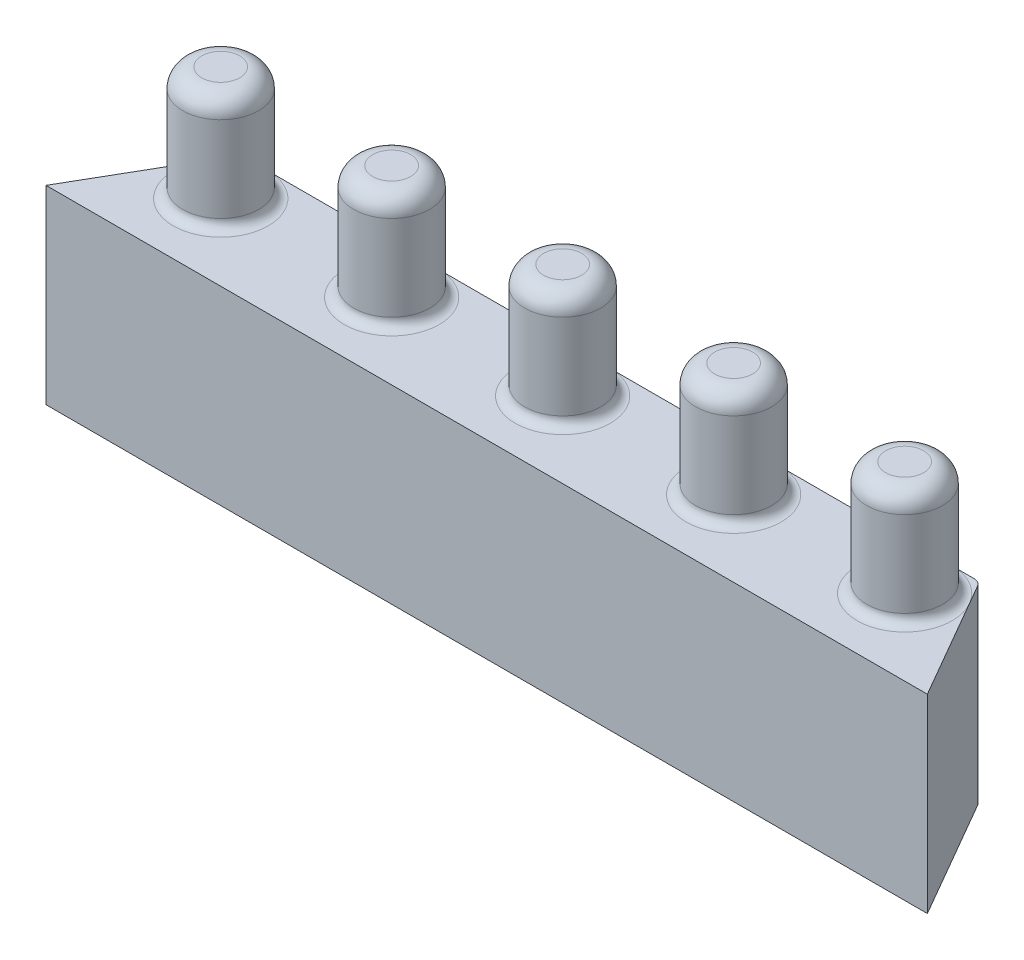
from build123d import *

# Parameters (mm, degrees)
SKETCH1_R           = 2
BOSS_EXTRUDE1_DEPTH = 10
SKETCH1_2_R         = 2
BOSS_EXTRUDE2_DEPTH = 16
FILLET1_R           = 1
FILLET2_R           = 0.5


with BuildPart() as part:
    # Sketch1 → Boss-Extrude1 (new body)
    with BuildSketch(Plane(origin=(0, 0, 0), x_dir=(1, 0, 0), z_dir=(0, 1, 0))):
        Polygon((-1.443375673, 2.5), (37.443375673, 2.5), (41.196152423, -4), (-5.196152423, -4), align=None)
        with Locations(Location((0, 0, 0), (0, 0, 270))):
            Circle(SKETCH1_R, mode=Mode.SUBTRACT)
        with Locations(Location((9, 0, 0), (0, 0, 270))):
            Circle(SKETCH1_R, mode=Mode.SUBTRACT)
        with Locations(Location((18, 0, 0), (0, 0, 270))):
            Circle(SKETCH1_R, mode=Mode.SUBTRACT)
        with Locations(Location((27, 0, 0), (0, 0, 270))):
            Circle(SKETCH1_R, mode=Mode.SUBTRACT)
        with Locations(Location((36, 0, 0), (0, 0, 270))):
            Circle(SKETCH1_R, mode=Mode.SUBTRACT)
    extrude(amount=BOSS_EXTRUDE1_DEPTH)

    # Sketch1<2> → Boss-Extrude2 (add)
    with BuildSketch(Plane(origin=(0, 0, 0), x_dir=(1, 0, 0), z_dir=(0, 1, 0))):
        with Locations(Location((0, 0, 0), (0, 0, 270))):
            Circle(SKETCH1_2_R)
        with Locations(Location((9, 0, 0), (0, 0, 270))):
            Circle(SKETCH1_2_R)
        with Locations(Location((18, 0, 0), (0, 0, 270))):
            Circle(SKETCH1_2_R)
        with Locations(Location((27, 0, 0), (0, 0, 270))):
            Circle(SKETCH1_2_R)
        with Locations(Location((36, 0, 0), (0, 0, 270))):
            Circle(SKETCH1_2_R)
    extrude(amount=BOSS_EXTRUDE2_DEPTH)

    # Fillet1
    fillet1_edges = [part.edges().sort_by_distance(p)[0] for p in [
        (0, 16, -2),
        (9, 16, -2),
        (18, 16, -2),
        (27, 16, -2),
        (36, 16, -2),
    ]]
    fillet(fillet1_edges, radius=FILLET1_R)

    # Fillet2
    fillet2_edges = [part.edges().sort_by_distance(p)[0] for p in [
        (0, 10, -2),
        (9, 10, -2),
        (18, 10, -2),
        (27, 10, -2),
        (36, 10, -2),
        (-1.443375673, 5, -2.5),
        (37.443375673, 5, -2.5),
    ]]
    fillet(fillet2_edges, radius=FILLET2_R - 0.0001)  # a hair under: the kernel refuses the full size


solid = part.part
